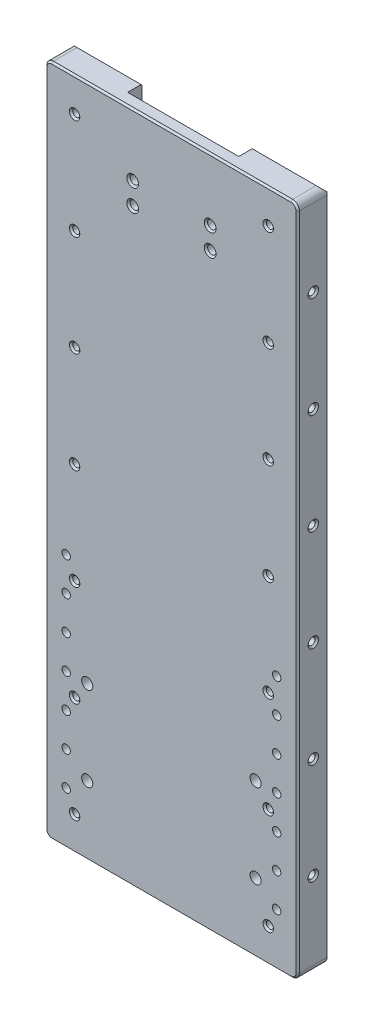
from build123d import *

# Parameters (mm, degrees)
SKETCH1_W                 = 150
SKETCH1_H                 = 400
BOSS_EXTRUDE1_DEPTH       = 18.5
CUT_EXTRUDE1_DEPTH        = 11.5
FILLET1_R                 = 4
CUT_EXTRUDE3_DEPTH        = 8
M6X1_0_TAPPED_HOLE1_D     = 5
M6X1_0_TAPPED_HOLE1_DEPTH = 13.497848452
M6X1_0_TAPPED_HOLE1_TIP   = 1.502151548
M5X0_8_TAPPED_HOLE1_D     = 4.2
FILLET5_R                 = 4
CHAMFER2_SIZE             = 1
FILLET6_R                 = 4
CHAMFER4_SIZE             = 3.5
CHAMFER5_SIZE             = 1
SKETCH15_R                = 2.1
CUT_EXTRUDE5_DEPTH        = 17
CUT_EXTRUDE6_START        = -17
SKETCH16_R                = 2.1
CUT_EXTRUDE6_DEPTH        = 17
CHAMFER6_SIZE             = 1
SKETCH18_R                = 2.5
SKETCH18_R_2              = 3.3
CUT_EXTRUDE7_DEPTH        = 330.906426127
SKETCH21_W                = 14
SKETCH21_H                = 257.425173829
CUT_EXTRUDE9_DEPTH        = 4
FILLET7_R                 = 5
CHAMFER8_SIZE             = 3


# Some blends are built 0.0001 mm under size
with BuildPart() as part:
    # Sketch1 → Boss-Extrude1 (new body)
    with BuildSketch(Plane.XY):
        with Locations((61, 100)):
            Rectangle(SKETCH1_W, SKETCH1_H)
    extrude(amount=BOSS_EXTRUDE1_DEPTH)

    # Sketch2 → Cut-Extrude1 (cut)
    with BuildSketch(Plane.XY):
        Polygon((94, 272), (94, 300), (28, 300), (28, 272), (28, 270), (28, 240), (94, 240), (94, 270), align=None)
    extrude(amount=CUT_EXTRUDE1_DEPTH, mode=Mode.SUBTRACT)

    # Fillet1
    fillet1_edges = [part.edges().sort_by_distance(p)[0] for p in [
        (28, 240, 5.75),
        (94, 240, 5.75),
    ]]
    fillet(fillet1_edges, radius=FILLET1_R)

    # Sketch6 → Cut-Extrude3 (cut)
    with BuildSketch(Plane(origin=(0, 0, 0), x_dir=(-1, 0, 0), z_dir=(0, 0, -1))):
        Polygon((-42, 240), (-42, 300), (-80, 300), (-80, 240), (-80, 50), (-80, 44), (-80, -9), (-80, -25), (-42, -25), (-42, -9), (-42, 44), (-42, 50), align=None)
    extrude(amount=-CUT_EXTRUDE3_DEPTH, mode=Mode.SUBTRACT)

    # M6x1.0 Tapped Hole1
    with Locations(Plane(origin=(0, 0, 11.5), x_dir=(-1, 0, 0), z_dir=(0, 0, -1))):
        with Locations((-84, 263), (-38, 263), (-38, 250), (-84, 250)):
            Hole(M6X1_0_TAPPED_HOLE1_D / 2, depth=M6X1_0_TAPPED_HOLE1_DEPTH)
            with Locations((0, 0, -(M6X1_0_TAPPED_HOLE1_DEPTH + M6X1_0_TAPPED_HOLE1_TIP / 2))):  # 118° drill point
                Cone(0, M6X1_0_TAPPED_HOLE1_D / 2, M6X1_0_TAPPED_HOLE1_TIP, mode=Mode.SUBTRACT)

    # M5x0.8 Tapped Hole1 (through all)
    with Locations(Plane(origin=(0, 0, 0), x_dir=(-1, 0, 0), z_dir=(0, 0, -1))):
        with Locations((-118.5, 280), (-3.5, 280), (-118.5, 220), (-3.5, 220), (-3.5, 160), (-118.5, 160), (-118.5, 100), (-3.5, 100), (-3.5, 40), (-118.5, 40), (-3.5, -20), (-118.5, -20), (-118.5, -80), (-3.5, -80)):
            Hole(M5X0_8_TAPPED_HOLE1_D / 2)

    # Fillet5
    fillet5_edges = [part.edges().sort_by_distance(p)[0] for p in [
        (-14, 300, 9.25),
        (136, 300, 9.25),
        (136, -100, 9.25),
        (-14, -100, 9.25),
    ]]
    fillet(fillet5_edges, radius=FILLET5_R)

    # Chamfer2
    chamfer2_edges = [part.edges().sort_by_distance(p)[0] for p in [
        (1.4, -80, 18.5),
        (116.4, -80, 18.5),
        (116.4, -20, 18.5),
        (1.4, -20, 18.5),
        (116.4, 40, 18.5),
        (1.4, 40, 18.5),
        (1.4, 100, 18.5),
        (116.4, 100, 18.5),
        (116.4, 160, 18.5),
        (1.4, 160, 18.5),
        (1.4, 220, 18.5),
        (116.4, 220, 18.5),
        (1.4, 280, 18.5),
        (116.4, 280, 18.5),
        (61, -100, 18.5),
        (-14, 100, 18.5),
        (136, 100, 18.5),
        (61, 300, 18.5),
        (-12.828427125, 298.828427125, 18.5),
        (134.828427125, 298.828427125, 18.5),
        (134.828427125, -98.828427125, 18.5),
        (-12.828427125, -98.828427125, 18.5),
        (81.5, 250, 18.5),
        (35.5, 250, 18.5),
        (35.5, 263, 18.5),
        (81.5, 263, 18.5),
    ]]
    chamfer(chamfer2_edges, length=CHAMFER2_SIZE)

    # Fillet6
    fillet6_edges = [part.edges().sort_by_distance(p)[0] for p in [
        (42, 240, 4),
        (80, 240, 4),
        (80, -25, 4),
        (42, -25, 4),
    ]]
    fillet(fillet6_edges, radius=FILLET6_R)

    # Chamfer4
    # the kernel refuses this chamfer: 3.5 mm, written as the material it takes off along each edge
    with BuildSketch(Plane(origin=(-19.000890458, 300, 0), x_dir=(0, -0.9996219169112968, -0.02749587661058649), z_dir=(1, 0, 0)), Plane(origin=(84.999109542, 300, 0), x_dir=(0, -0.9996219169112968, -0.02749587661058649), z_dir=(1, 0, 0))) as chamfer4_piece_1:
        Polygon((CHAMFER4_SIZE * 0.999621916911, -CHAMFER4_SIZE * 0.0274958766106), (-CHAMFER4_SIZE * 0.0274958766106, -CHAMFER4_SIZE * 0.999621916911), (0, 0), align=None)
    extrude(amount=56.001780916, mode=Mode.SUBTRACT)

    # Chamfer5
    chamfer5_edges = [part.edges().sort_by_distance(p)[0] for p in [
        (135.992149037, 296.25049165, 0),
        (136, 100, 0),
        (134.828427125, -98.828427125, 0),
        (61, -100, 0),
        (-13.992149037, 296.25049165, 0),
        (-12.828427125, -98.828427125, 0),
        (-14, 100, 0),
    ]]
    chamfer(chamfer5_edges, length=CHAMFER5_SIZE)

    # Sketch15 → Cut-Extrude5 (cut)
    with BuildSketch(Plane.ZY.offset(14)):
        with Locations(Location((9.25, 250, 0), (0, 0, 270))):
            Circle(SKETCH15_R)
        with Locations(Location((9.25, 190, 0), (0, 0, 270))):
            Circle(SKETCH15_R)
        with Locations(Location((9.25, 130, 0), (0, 0, 270))):
            Circle(SKETCH15_R)
        with Locations(Location((9.25, 70, 0), (0, 0, 270))):
            Circle(SKETCH15_R)
        with Locations(Location((9.25, 10, 0), (0, 0, 270))):
            Circle(SKETCH15_R)
        with Locations(Location((9.25, -50, 0), (0, 0, 270))):
            Circle(SKETCH15_R)
    extrude(amount=-CUT_EXTRUDE5_DEPTH, mode=Mode.SUBTRACT)

    # Sketch16 → Cut-Extrude6 (cut)
    with BuildSketch(Plane(origin=(136, 0, 0), x_dir=(0, 0, -1), z_dir=(1, 0, 0)).offset(CUT_EXTRUDE6_START)):
        with Locations(Location((-9.25, 250, 0), (0, 0, 270))):
            Circle(SKETCH16_R)
        with Locations(Location((-9.25, 190, 0), (0, 0, 270))):
            Circle(SKETCH16_R)
        with Locations(Location((-9.25, 130, 0), (0, 0, 270))):
            Circle(SKETCH16_R)
        with Locations(Location((-9.25, 70, 0), (0, 0, 270))):
            Circle(SKETCH16_R)
        with Locations(Location((-9.25, 10, 0), (0, 0, 270))):
            Circle(SKETCH16_R)
        with Locations(Location((-9.25, -50, 0), (0, 0, 270))):
            Circle(SKETCH16_R)
    extrude(amount=CUT_EXTRUDE6_DEPTH, mode=Mode.SUBTRACT)

    # Chamfer6
    chamfer6_edges = [part.edges().sort_by_distance(p)[0] for p in [
        (1.4, -80, 0),
        (116.4, -80, 0),
        (116.4, -20, 0),
        (1.4, -20, 0),
        (116.4, 40, 0),
        (1.4, 40, 0),
        (1.4, 100, 0),
        (116.4, 100, 0),
        (116.4, 160, 0),
        (1.4, 160, 0),
        (1.4, 220, 0),
        (116.4, 220, 0),
        (1.4, 280, 0),
        (116.4, 280, 0),
        (-14, 252.1, 9.25),
        (-14, 192.1, 9.25),
        (-14, 132.1, 9.25),
        (-14, 72.1, 9.25),
        (-14, 12.1, 9.25),
        (-14, -47.9, 9.25),
        (136, 252.1, 9.25),
        (136, 192.1, 9.25),
        (136, 132.1, 9.25),
        (136, 72.1, 9.25),
        (136, 12.1, 9.25),
        (136, -47.9, 9.25),
    ]]
    chamfer(chamfer6_edges, length=CHAMFER6_SIZE)

    # Sketch18 → Cut-Extrude7 (cut, through all)
    with BuildSketch(Plane.XY.offset(18.5)):
        with Locations((123.5, -69)):
            Circle(SKETCH18_R)
        with Locations((-1.5, -69)):
            Circle(SKETCH18_R)
        with Locations((-1.5, -49)):
            Circle(SKETCH18_R)
        with Locations((-1.5, -29)):
            Circle(SKETCH18_R)
        with Locations((-1.5, -9)):
            Circle(SKETCH18_R)
        with Locations((123.5, -49)):
            Circle(SKETCH18_R)
        with Locations((123.5, -29)):
            Circle(SKETCH18_R)
        with Locations((123.5, -9)):
            Circle(SKETCH18_R)
        with Locations((123.5, 11)):
            Circle(SKETCH18_R)
        with Locations((-1.5, 11)):
            Circle(SKETCH18_R)
        with Locations((123.5, 31)):
            Circle(SKETCH18_R)
        with Locations((-1.5, 31)):
            Circle(SKETCH18_R)
        with Locations((123.5, 51)):
            Circle(SKETCH18_R)
        with Locations((-1.5, 51)):
            Circle(SKETCH18_R)
        with Locations((111, -59)):
            Circle(SKETCH18_R_2)
        with Locations((11, -59)):
            Circle(SKETCH18_R_2)
        with Locations((11, -9)):
            Circle(SKETCH18_R_2)
        with Locations((111, -9)):
            Circle(SKETCH18_R_2)
    extrude(amount=-CUT_EXTRUDE7_DEPTH, mode=Mode.SUBTRACT)

    # Sketch21 → Cut-Extrude9 (cut)
    with BuildSketch(Plane(origin=(0, 0, 0), x_dir=(-1, 0, 0), z_dir=(0, 0, -1))):
        Polygon((-51, -25), (-51, -28), (-51, -58), (-71, -58), (-71, -28), (-71, -25), align=None)
        with Locations((-35, 115.287413086)):
            Rectangle(SKETCH21_W, SKETCH21_H)
    extrude(amount=-CUT_EXTRUDE9_DEPTH, mode=Mode.SUBTRACT)

    # Fillet7
    fillet7_edges = [part.edges().sort_by_distance(p)[0] for p in [
        (71, -58, 2),
        (51, -58, 2),
        (28, -13.425173829, 2),
    ]]
    fillet(fillet7_edges, radius=FILLET7_R)
    fillet7_2_edges = [part.edges().sort_by_distance(p)[0] for p in [
        (51, -25, 2),
        (71, -25, 2),
        (42, -13.425173829, 2),
    ]]
    fillet(fillet7_2_edges, radius=FILLET7_R - 0.0001)  # a hair under: the kernel refuses the full size

    # Chamfer8
    chamfer8_edges = [part.edges().sort_by_distance(p)[0] for p in [
        (42, -19.712536914, 0),
        (94, 270.25, 0),
        (87, 240, 0),
        (80, 107.5, 0),
        (81.171572875, 238.828427125, 0),
        (43.171572875, -23.828427125, 0),
        (78.828427125, -23.828427125, 0),
        (92.828427125, 241.171572875, 0),
        (28, 144.037413086, 0),
        (35.00005, -13.425173829, 0),
        (51, -41.49995, 0),
        (61, -58, 0),
        (71, -41.49995, 0),
        (72.464436805, -26.464436805, 0),
        (49.535563195, -26.464436805, 0),
        (40.535563195, -14.889610634, 0),
        (29.464466094, -11.960707735, 0),
        (69.535533906, -56.535533906, 0),
        (52.464466094, -56.535533906, 0),
    ]]
    chamfer(chamfer8_edges, length=CHAMFER8_SIZE)


solid = part.part
